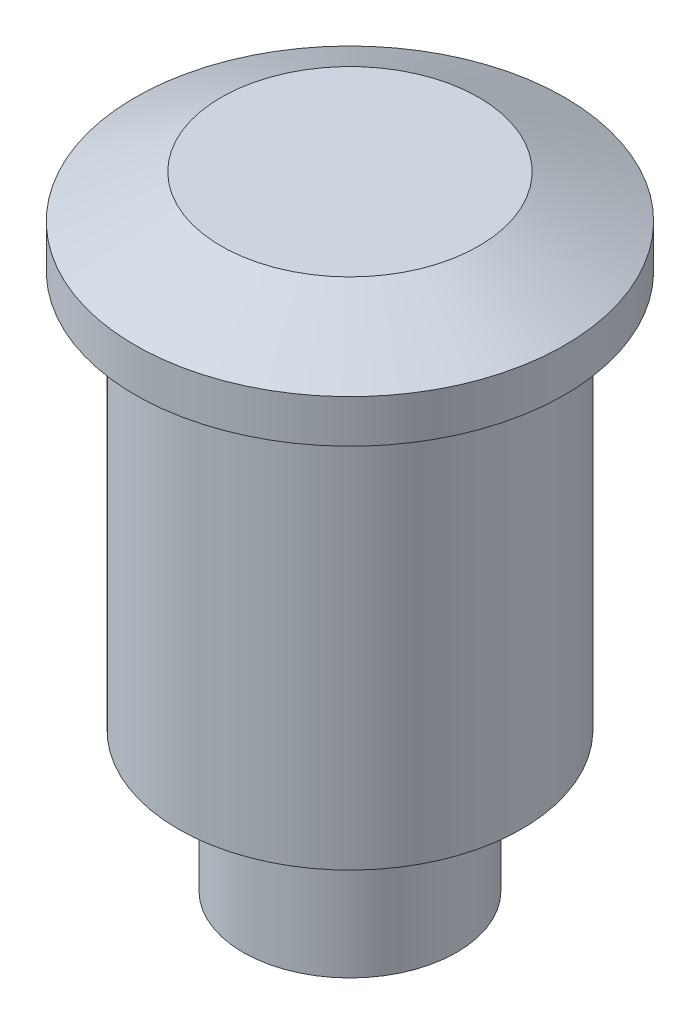
from build123d import *


with BuildPart() as part:
    # Esquisse1 → Révolution1 (revolve)
    with BuildSketch(Plane.XY):
        Polygon((0, 59.819980708), (3, 59.819980708), (5, 58.819980708), (5, 57.819980708), (4, 57.819980708), (4, 48.565491805), (2.485951674, 48.565491805), (2.485951674, 45.319980708), (0, 45.319980708), align=None)
    revolve(axis=Axis((0, 0, 0), (0, 1, 0)))


solid = part.part
